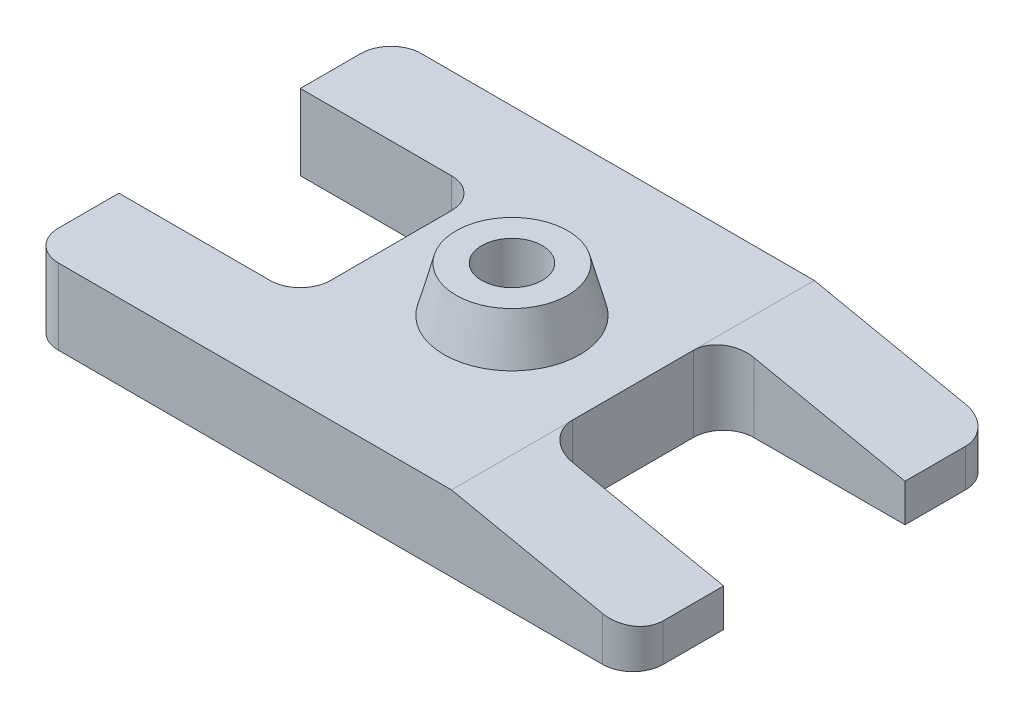
from build123d import *

# Parameters (mm, degrees)
SKETCH1_W               = 200
SKETCH1_H               = 120
SKETCH1_R               = 22.5
BOSS_EXTRUDE1_DEPTH     = 25
SKETCH1_3_R             = 22.5
BOSS_EXTRUDE2_DEPTH     = 40
SKETCH2_R               = 10
CUT_EXTRUDE1_DEPTH      = 124.288280059
FILLET1_R               = 10
SKETCH3_W               = 60
SKETCH3_H               = 60
CUT_EXTRUDE2_DEPTH      = 120.268604419
FILLET2_R               = 10
CUT_EXTRUDE3_DEPTH      = 124.288280059
CUT_EXTRUDE3_DEPTH_BACK = 124.288280059


# Read off the part's stored shape, not the designer's step: Draft1
with BuildPart() as part:
    # Sketch1 → Boss-Extrude1 (new body)
    with BuildSketch(Plane(origin=(0, 0, 0), x_dir=(1, 0, 0), z_dir=(0, 1, 0))):
        Rectangle(SKETCH1_W, SKETCH1_H)
        with Locations(Location((0, 0, 0), (0, 0, 270))):
            Circle(SKETCH1_R, mode=Mode.SUBTRACT)
    extrude(amount=BOSS_EXTRUDE1_DEPTH)

    # Sketch1<3> → Boss-Extrude2 (add)
    with BuildSketch(Plane(origin=(0, 0, 0), x_dir=(1, 0, 0), z_dir=(0, 1, 0))):
        with Locations(Location((0, 0, 0), (0, 0, 270))):
            Circle(SKETCH1_3_R)
    extrude(amount=BOSS_EXTRUDE2_DEPTH)

    # Draft1 outline → Draft1 (revolve, cut)
    with BuildSketch(Plane.XY):
        Polygon((22.5, 40), (18.480762114, 40), (22.5, 25), align=None)
    revolve(axis=Axis((0, 0, 0), (0, 1, 0)), mode=Mode.SUBTRACT)

    # Sketch2 → Cut-Extrude1 (cut, through all)
    with BuildSketch(Plane(origin=(0, 40, 0), x_dir=(1, 0, 0), z_dir=(0, 1, 0))):
        with Locations(Location((0, 0, 0), (0, 0, 270))):
            Circle(SKETCH2_R)
    extrude(amount=-CUT_EXTRUDE1_DEPTH, mode=Mode.SUBTRACT)

    # Fillet1
    fillet1_edges = [part.edges().sort_by_distance(p)[0] for p in [
        (-100, 12.5, -60),
        (100, 12.5, -60),
        (100, 12.5, 60),
        (-100, 12.5, 60),
    ]]
    fillet(fillet1_edges, radius=FILLET1_R)

    # Sketch3 → Cut-Extrude2 (cut, through all)
    with BuildSketch(Plane(origin=(0, 25, 0), x_dir=(1, 0, 0), z_dir=(0, 1, 0))):
        with Locations((-70, 0)):
            Rectangle(SKETCH3_W, SKETCH3_H)
        with Locations((70, 0)):
            Rectangle(SKETCH3_W, SKETCH3_H)
    extrude(amount=-CUT_EXTRUDE2_DEPTH, mode=Mode.SUBTRACT)

    # Fillet2
    fillet2_edges = [part.edges().sort_by_distance(p)[0] for p in [
        (-40, 12.5, -30),
        (-40, 12.5, 30),
        (40, 12.5, -30),
        (40, 12.5, 30),
    ]]
    fillet(fillet2_edges, radius=FILLET2_R)

    # Sketch4 → Cut-Extrude3 (cut, two sides: drawn at the far end of the back side and taken through both)
    with BuildSketch(Plane.XY.offset(-CUT_EXTRUDE3_DEPTH_BACK)):
        Polygon((40, 25), (100, 12.5), (100, 25), align=None)
    extrude(amount=CUT_EXTRUDE3_DEPTH + CUT_EXTRUDE3_DEPTH_BACK, mode=Mode.SUBTRACT)


solid = part.part
